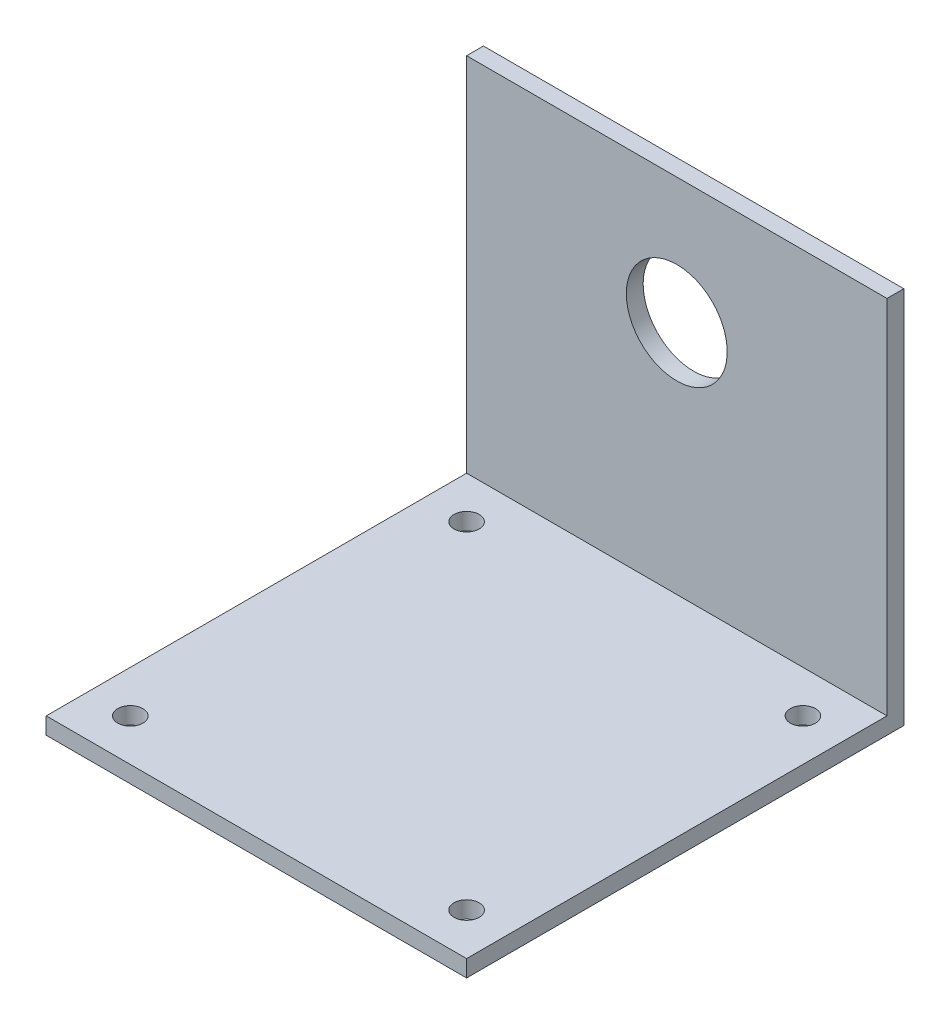
from build123d import *

# Parameters (mm, degrees)
SKETCH1_W           = 50
SKETCH1_H           = 50
BOSS_EXTRUDE1_DEPTH = 2
SKETCH2_W           = 50
SKETCH2_H           = 45
SKETCH2_R           = 6
BOSS_EXTRUDE2_DEPTH = 2
SKETCH3_R           = 1.5
CUT_EXTRUDE1_DEPTH  = 10


with BuildPart() as part:
    # Sketch1 → Boss-Extrude1 (new body)
    with BuildSketch(Plane(origin=(0, 0, 0), x_dir=(1, 0, 0), z_dir=(0, 1, 0))):
        with Locations((25, -25)):
            Rectangle(SKETCH1_W, SKETCH1_H)
    extrude(amount=BOSS_EXTRUDE1_DEPTH)

    # Sketch2 → Boss-Extrude2 (add)
    with BuildSketch(Plane(origin=(0, 0, 0), x_dir=(-1, 0, 0), z_dir=(0, 0, -1))):
        with Locations((-25, 22.5)):
            Rectangle(SKETCH2_W, SKETCH2_H)
        with Locations((-25, 30)):
            Circle(SKETCH2_R, mode=Mode.SUBTRACT)
    extrude(amount=BOSS_EXTRUDE2_DEPTH)

    # Sketch3 → Cut-Extrude1 (cut)
    with BuildSketch(Plane(origin=(0, 2, 0), x_dir=(1, 0, 0), z_dir=(0, 1, 0))):
        with Locations((45, -45)):
            Circle(SKETCH3_R)
        with Locations((5, -45)):
            Circle(SKETCH3_R)
        with Locations((45, -5)):
            Circle(SKETCH3_R)
        with Locations((5, -5)):
            Circle(SKETCH3_R)
    extrude(amount=-CUT_EXTRUDE1_DEPTH, mode=Mode.SUBTRACT)


solid = part.part
